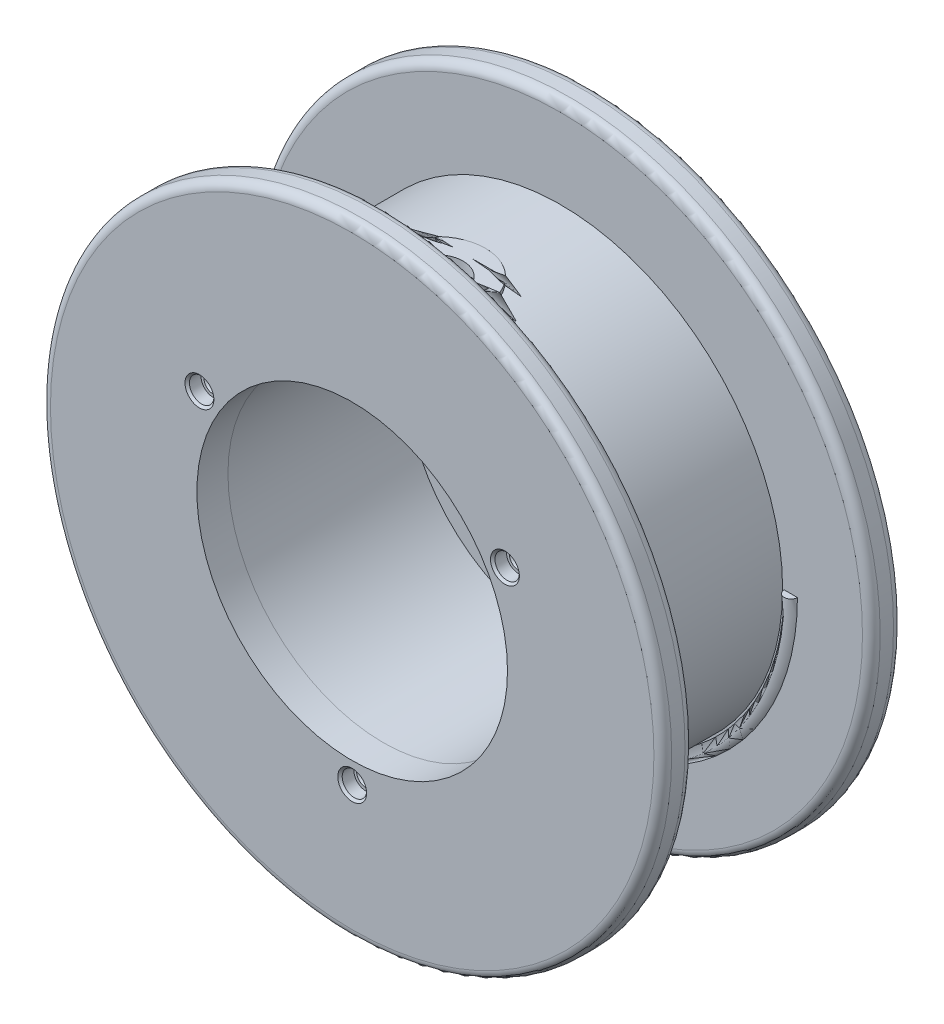
from build123d import *

# Parameters (mm, degrees)
SKETCH1_R                    = 50
BOSS_EXTRUDE1_DEPTH          = 20
BOSS_EXTRUDE2_START          = -20
SKETCH2_R                    = 70
BOSS_EXTRUDE2_DEPTH          = 7
BOSS_EXTRUDE3_START          = 27
SKETCH2_3_R                  = 70
BOSS_EXTRUDE3_DEPTH          = 7
CUT_EXTRUDE1_DEPTH           = 103.610915599
BOSS_EXTRUDE4_START          = 48.774994
SKETCH3_3_R                  = 11
BOSS_EXTRUDE4_DEPTH          = 1.225006
SKETCH4_R                    = 35
CUT_EXTRUDE2_DEPTH           = 47
BOSS_EXTRUDE8_REACH          = 136.611
BOSS_EXTRUDE8_END_RADIUS     = 35
BOSS_EXTRUDE8_START          = 32
SKETCH3_5_R                  = 11
SKETCH6_R                    = 2.1
CUT_EXTRUDE5_DEPTH           = 103.610915625
CUT_EXTRUDE6_START           = -27
SKETCH6_4_R                  = 2.1
CUT_EXTRUDE6_DEPTH           = 3.5
BOSS_EXTRUDE9_START          = -14
SKETCH6_7_R                  = 3.5
SKETCH6_7_R_2                = 2.1
BOSS_EXTRUDE9_DEPTH          = 6
CHAMFER2_SIZE                = 3
FILLET1_R                    = 3
CIRPATTERN5_COUNT            = 3
FILLET1_OF_CIRPATTERN5_R     = 3
FILLET2_R                    = 2
CUT_EXTRUDE7_START           = 20
SKETCH9_R                    = 1.6
CUT_EXTRUDE7_DEPTH           = 83.610915667
CUT_EXTRUDE9_START           = 27
SKETCH9_3_R                  = 2.75
SKETCH9_3_R_2                = 1.6
CUT_EXTRUDE9_DEPTH           = 3.1
CHAMFER3_SIZE                = 0.5
CIRPATTERN6_COUNT            = 3
CHAMFER3_OF_CIRPATTERN6_SIZE = 0.5
CUT_EXTRUDE10_START          = 20
SKETCH10_R                   = 1.4
CUT_EXTRUDE10_DEPTH          = 13.1
CHAMFER4_SIZE                = 0.5
CIRPATTERN9_COUNT            = 3
CHAMFER4_OF_CIRPATTERN9_SIZE = 0.5
SWEEP2_PITCH                 = 4.375
SWEEP2_HEIGHT                = 35
SWEEP2_RADIUS                = 52
SKETCH13_R                   = 1.5


with BuildPart() as part:
    # Sketch1 → Boss-Extrude1 (new, symmetric)
    with BuildSketch(Plane.XY):
        Circle(SKETCH1_R)
    extrude(amount=BOSS_EXTRUDE1_DEPTH, both=True)

    # Sketch2 → Boss-Extrude2 (add)
    with BuildSketch(Plane.XY.offset(BOSS_EXTRUDE2_START)):
        Circle(SKETCH2_R)
    extrude(amount=-BOSS_EXTRUDE2_DEPTH)

    # Sketch2<3> → Boss-Extrude3 (add)
    with BuildSketch(Plane.XY.offset(BOSS_EXTRUDE3_START)):
        Circle(SKETCH2_3_R)
    extrude(amount=-BOSS_EXTRUDE3_DEPTH)

    # Sketch3 → Cut-Extrude1 (cut, through all)
    with BuildSketch(Plane(origin=(0, 0, 0), x_dir=(1, 0, 0), z_dir=(0, 1, 0))):
        with BuildLine():
            Line((-2.307692308, -13.538461538), (0, -14.5))
            Line((0, -14.5), (2.307692308, -13.538461538))
            ThreePointArc((2.307692308, -13.538461538), (0, -2), (-2.307692308, -13.538461538))
        make_face()
    extrude(amount=CUT_EXTRUDE1_DEPTH, mode=Mode.SUBTRACT)

    # Sketch3<3> → Boss-Extrude4 (add)
    with BuildSketch(Plane(origin=(0, 0, 0), x_dir=(1, 0, 0), z_dir=(0, 1, 0)).offset(BOSS_EXTRUDE4_START)):
        with Locations((0, -8)):
            Circle(SKETCH3_3_R)
        with BuildLine():
            Line((-2.307692308, -13.538461538), (0, -14.5))
            Line((0, -14.5), (2.307692308, -13.538461538))
            ThreePointArc((2.307692308, -13.538461538), (0, -2), (-2.307692308, -13.538461538))
        make_face(mode=Mode.SUBTRACT)
    extrude(amount=BOSS_EXTRUDE4_DEPTH)

    # Sketch4 → Cut-Extrude2 (cut)
    with BuildSketch(Plane.XY.offset(27)):
        Circle(SKETCH4_R)
    extrude(amount=-CUT_EXTRUDE2_DEPTH, mode=Mode.SUBTRACT)

    # Boss-Extrude8: up to this cylinder (the profile starts inside it)
    boss_extrude8_end = Plane(origin=(0, 0, 18.688873), z_dir=(0, 0, 1)) * Cylinder(BOSS_EXTRUDE8_END_RADIUS, 344.222, mode=Mode.PRIVATE)
    # Sketch3<5> → Boss-Extrude8 (add, up to the surface)
    with BuildSketch(Plane(origin=(0, 0, 0), x_dir=(1, 0, 0), z_dir=(0, 1, 0)).offset(BOSS_EXTRUDE8_START), mode=Mode.PRIVATE) as boss_extrude8_sk1:
        with Locations(Location((0, -8, 0), (0, 0, 90))):
            Circle(SKETCH3_5_R)
        with BuildLine():
            Line((-2.307692308, -13.538461538), (0, -14.5))
            Line((0, -14.5), (2.307692308, -13.538461538))
            ThreePointArc((2.307692308, -13.538461538), (0, -2), (-2.307692308, -13.538461538))
        make_face(mode=Mode.SUBTRACT)
    boss_extrude8_tool1 = extrude(boss_extrude8_sk1.sketch, amount=BOSS_EXTRUDE8_REACH, mode=Mode.PRIVATE) & boss_extrude8_end
    add(boss_extrude8_tool1.solids().sort_by_distance((0, 32, 18.688873))[0])

    # Sketch6 → Cut-Extrude5 (cut, through all)
    with BuildSketch(Plane.XY):
        with Locations((0, 15)):
            Circle(SKETCH6_R)
    cut_extrude5 = extrude(amount=-CUT_EXTRUDE5_DEPTH, mode=Mode.SUBTRACT)

    # Sketch6<4> → Cut-Extrude6 (cut)
    with BuildSketch(Plane.XY.offset(CUT_EXTRUDE6_START)):
        with Locations((0, -14.25)):
            Circle(SKETCH6_4_R)
    cut_extrude6 = extrude(amount=CUT_EXTRUDE6_DEPTH, mode=Mode.SUBTRACT)

    # Sketch6<7> → Boss-Extrude9 (add)
    with BuildSketch(Plane.XY.offset(BOSS_EXTRUDE9_START)):
        with Locations((0, 15)):
            Circle(SKETCH6_7_R)
        with Locations((0, 15)):
            Circle(SKETCH6_7_R_2, mode=Mode.SUBTRACT)
    boss_extrude9 = extrude(amount=-BOSS_EXTRUDE9_DEPTH)

    # Chamfer2
    # the kernel refuses this chamfer: 3 mm, written as the material it takes off along each edge
    with BuildSketch(Plane(origin=(0, 32, 8), x_dir=(0, 0, -1), z_dir=(1, 0, 0))) as chamfer2_piece_1_section:
        Polygon((11 - CHAMFER2_SIZE, 0), (11, CHAMFER2_SIZE), (11, 0), align=None)
    chamfer2_piece_1 = revolve(axis=Axis((0, 32, 8), (0, 1, 0)), mode=Mode.PRIVATE)
    chamfer2_piece_1 = chamfer2_piece_1 & Plane(origin=(0, 0, 17.503518849), x_dir=(1, 0, 0), z_dir=(0, 0, 1)) * Cylinder(35, 44, mode=Mode.PRIVATE)
    add(chamfer2_piece_1, mode=Mode.SUBTRACT)

    # Fillet1
    fillet1_edges = [part.edges().sort_by_distance(p)[0] for p in [
        (-3.5, 15, -20),
    ]]
    fillet(fillet1_edges, radius=FILLET1_R)

    # CirPattern5: Cut-Extrude5, Cut-Extrude6, Boss-Extrude9 ×3 about axis
    cirpattern5_axis = Axis((0, 0, 0), (0, 0, 1))
    add([cut_extrude5.rotate(cirpattern5_axis, i * 360 / CIRPATTERN5_COUNT) for i in range(1, CIRPATTERN5_COUNT)], mode=Mode.SUBTRACT)
    add([cut_extrude6.rotate(cirpattern5_axis, i * 360 / CIRPATTERN5_COUNT) for i in range(1, CIRPATTERN5_COUNT)], mode=Mode.SUBTRACT)
    add([boss_extrude9.rotate(cirpattern5_axis, i * 360 / CIRPATTERN5_COUNT) for i in range(1, CIRPATTERN5_COUNT)])

    # Fillet1 of CirPattern5
    fillet1_of_cirpattern5_edges = [part.edges().sort_by_distance(p)[0] for p in [
        (-11.240381057, -10.531088913, -20),
        (14.740381057, -4.468911087, -20),
    ]]
    fillet(fillet1_of_cirpattern5_edges, radius=FILLET1_OF_CIRPATTERN5_R)

    # Fillet2
    fillet2_edges = [part.edges().sort_by_distance(p)[0] for p in [
        (-70, 0, 20),
        (-70, 0, 27),
        (-70, 0, -27),
        (-70, 0, -20),
    ]]
    fillet(fillet2_edges, radius=FILLET2_R)


with BuildPart() as body_2:
    # Split1: the piece on the far side of the plane
    add(part.part)
    split(bisect_by=Plane(origin=(0, 0, 20), x_dir=(-1, 0, 0), z_dir=(0, 0, -1)), keep=Keep.BOTTOM)

    # Sketch9 → Cut-Extrude7 (cut, through all)
    with BuildSketch(Plane.XY.offset(CUT_EXTRUDE7_START)):
        with Locations(Location((0, -39.75, 0), (0, 0, 180))):
            Circle(SKETCH9_R)
    cut_extrude7 = extrude(amount=CUT_EXTRUDE7_DEPTH, mode=Mode.SUBTRACT)

    # Sketch9<3> → Cut-Extrude9 (cut)
    with BuildSketch(Plane.XY.offset(CUT_EXTRUDE9_START)):
        with Locations((0, -39.75)):
            Circle(SKETCH9_3_R)
        with Locations(Location((0, -39.75, 0), (0, 0, 180))):
            Circle(SKETCH9_3_R_2, mode=Mode.SUBTRACT)
    cut_extrude9 = extrude(amount=-CUT_EXTRUDE9_DEPTH, mode=Mode.SUBTRACT)

    # Chamfer3
    chamfer3_edges = [body_2.edges().sort_by_distance(p)[0] for p in [
        (1.6, -39.75, 23.9),
        (-2.75, -39.75, 27),
    ]]
    chamfer(chamfer3_edges, length=CHAMFER3_SIZE)

    # CirPattern6: Cut-Extrude7, Cut-Extrude9 ×3 about axis
    cirpattern6_axis = Axis((0, 0, 0), (0, 0, 1))
    add([cut_extrude7.rotate(cirpattern6_axis, i * 360 / CIRPATTERN6_COUNT) for i in range(1, CIRPATTERN6_COUNT)], mode=Mode.SUBTRACT)
    add([cut_extrude9.rotate(cirpattern6_axis, i * 360 / CIRPATTERN6_COUNT) for i in range(1, CIRPATTERN6_COUNT)], mode=Mode.SUBTRACT)

    # Chamfer3 of CirPattern6
    chamfer3_of_cirpattern6_edges = [body_2.edges().sort_by_distance(p)[0] for p in [
        (33.6245098, 21.260640646, 23.9),
        (35.7995098, 17.49343014, 27),
        (-35.2245098, 18.489359354, 23.9),
        (-33.0495098, 22.25656986, 27),
    ]]
    chamfer(chamfer3_of_cirpattern6_edges, length=CHAMFER3_OF_CIRPATTERN6_SIZE)


with BuildPart() as part_1:
    add(part.part)

    # Split1
    split(bisect_by=Plane(origin=(0, 0, 20), x_dir=(-1, 0, 0), z_dir=(0, 0, -1)), keep=Keep.TOP)

    # Sketch10 → Cut-Extrude10 (cut)
    with BuildSketch(Plane.XY.offset(CUT_EXTRUDE10_START)):
        with Locations((0, -39.75)):
            Circle(SKETCH10_R)
    cut_extrude10 = extrude(amount=-CUT_EXTRUDE10_DEPTH, mode=Mode.SUBTRACT)

    # Chamfer4
    chamfer4_edges = [part_1.edges().sort_by_distance(p)[0] for p in [
        (-1.4, -39.75, 20),
    ]]
    chamfer(chamfer4_edges, length=CHAMFER4_SIZE)

    # CirPattern9: Cut-Extrude10 ×3 about axis
    cirpattern9_axis = Axis((0, 0, 0), (0, 0, 1))
    for i in range(1, CIRPATTERN9_COUNT):
        add(cut_extrude10.rotate(cirpattern9_axis, i * 360 / CIRPATTERN9_COUNT), mode=Mode.SUBTRACT)

    # Chamfer4 of CirPattern9
    chamfer4_of_cirpattern9_edges = [part_1.edges().sort_by_distance(p)[0] for p in [
        (35.1245098, 18.662564435, 20),
        (-33.7245098, 21.087435565, 20),
    ]]
    chamfer(chamfer4_of_cirpattern9_edges, length=CHAMFER4_OF_CIRPATTERN9_SIZE)

    # Sweep2: sweep along a helix
    with BuildLine() as sweep2_path:
        Helix(SWEEP2_PITCH, SWEEP2_HEIGHT, SWEEP2_RADIUS, center=(0, 0, -20), direction=(0, 0, 1), lefthand=True)
    # Sketch13 → Sweep2 (sweep)
    with BuildSketch(Plane(origin=(0, 0, 0), x_dir=(1, 0, 0), z_dir=(0, 1, 0))):
        with Locations((51.839223658, 20.019173484)):
            Circle(SKETCH13_R)
    sweep(path=sweep2_path.line, is_frenet=True)


solid = Compound([body_2.part, part_1.part])
